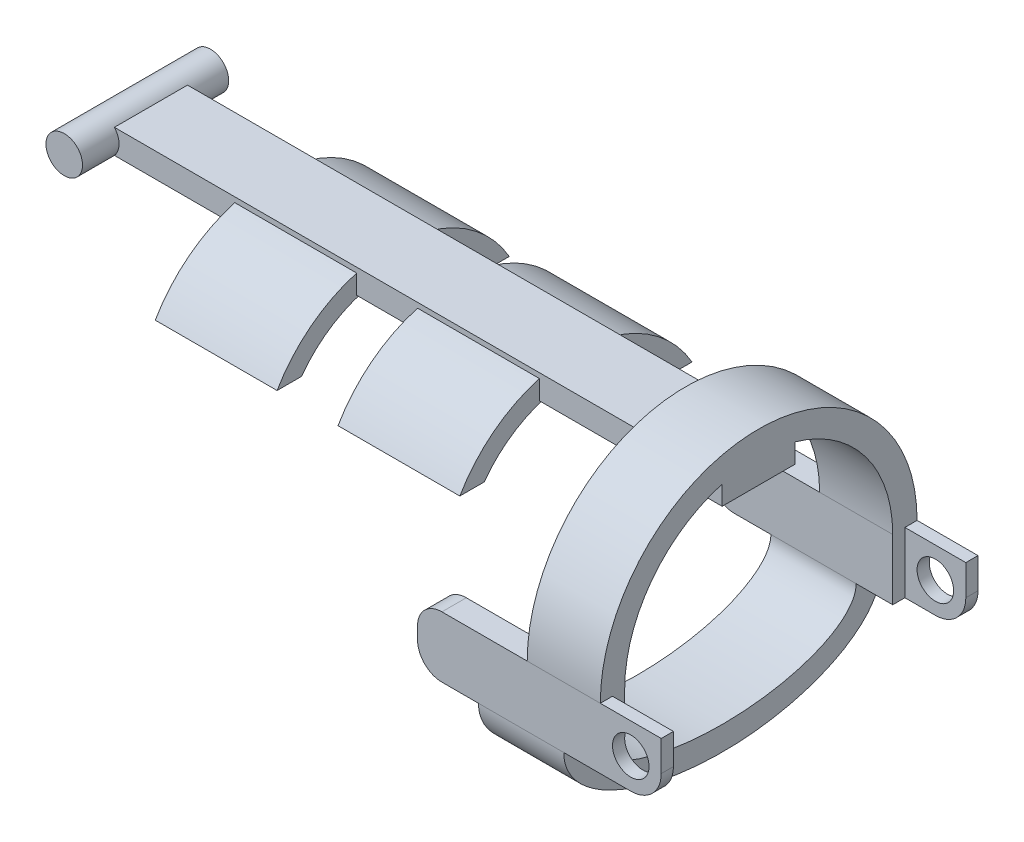
from build123d import *

# Parameters (mm, degrees)
SKETCH1_W                = 2
SKETCH1_H                = 5
BOSS_EXTRUDE1_DEPTH      = 15
BOSS_EXTRUDE1_2_DEPTH    = 15
SKETCH2_W                = 1
SKETCH2_H                = 5
BOSS_EXTRUDE2_DEPTH      = 5
CUT_EXTRUDE1_DEPTH       = 33.113081447
CUT_EXTRUDE1_DEPTH_BACK  = 33.113081447
SKETCH3_R                = 1.5
SWEEP1_START             = 9
SWEEP1_DEPTH             = 6
BOSS_EXTRUDE3_DEPTH      = 12
CUT_EXTRUDE2_DEPTH       = 5
FILLET1_R                = 2
BOSS_EXTRUDE6_START      = -6
SKETCH7_W                = 6
SKETCH7_H                = 2
BOSS_EXTRUDE6_DEPTH      = 51
BOSS_EXTRUDE7_DEPTH      = 3
BOSS_EXTRUDE7_DEPTH_BACK = 9
SKETCH8_R                = 1.5
FILLET2_R                = 2.5
BOSS_EXTRUDE10_DEPTH     = 10
LPATTERN1_COUNT          = 2
LPATTERN1_PITCH          = 15


# Read off the part's stored shape, not the designer's step: Sweep1
with BuildPart() as part:
    # Sketch1 → Boss-Extrude1 (new body)
    with BuildSketch(Plane(origin=(0, 0, 0), x_dir=(0, 0, -1), z_dir=(1, 0, 0))):
        with Locations((-12, 0)):
            Rectangle(SKETCH1_W, SKETCH1_H)
    extrude(amount=BOSS_EXTRUDE1_DEPTH)



with BuildPart() as body_2:
    # Sketch1 → Boss-Extrude1 2 (new body)
    with BuildSketch(Plane(origin=(0, 0, 0), x_dir=(0, 0, -1), z_dir=(1, 0, 0))):
        with Locations((12, 0)):
            Rectangle(SKETCH1_W, SKETCH1_H)
    extrude(amount=BOSS_EXTRUDE1_2_DEPTH)


with BuildPart() as part_1:
    add(part.part)

    add(body_2.part)  # Boss-Extrude2 merges body 2
    # Sketch2 → Boss-Extrude2 (add)
    with BuildSketch(Plane(origin=(15, 0, 0), x_dir=(0, 0, -1), z_dir=(1, 0, 0))):
        with Locations((12.5, 0)):
            Rectangle(SKETCH2_W, SKETCH2_H)
        with Locations((-12.5, 0)):
            Rectangle(SKETCH2_W, SKETCH2_H)
    extrude(amount=BOSS_EXTRUDE2_DEPTH)

    # Sketch3 → Cut-Extrude1 (cut, two sides: drawn at the far end of the back side and taken through both)
    with BuildSketch(Plane.XY.offset(-12).offset(-CUT_EXTRUDE1_DEPTH_BACK)):
        with Locations((17.5, 0)):
            Circle(SKETCH3_R)
    extrude(amount=CUT_EXTRUDE1_DEPTH + CUT_EXTRUDE1_DEPTH_BACK, mode=Mode.SUBTRACT)

    # Sweep1 outline → Sweep1 (add)
    with BuildSketch(Plane.YZ.offset(SWEEP1_START)):
        with BuildLine():
            ThreePointArc((2.5, -13), (15.5, 0), (2.5, 13))
            Line((2.5, 13), (2.5, 11))
            ThreePointArc((2.5, 11), (13.5, 0), (2.5, -11))
            Line((2.5, -11), (2.5, -13))
        make_face()
    extrude(amount=SWEEP1_DEPTH)

    # Sketch5 → Boss-Extrude3 (add)
    with BuildSketch(Plane(origin=(0, 0, 0), x_dir=(0, 0, -1), z_dir=(1, 0, 0))):
        with BuildLine():
            Line((-11, -2.5), (-13, -2.5))
            add(Edge.make_bspline(
                [(-13, -2.5), (-13, -8.980170496), (0, -8.980170496)],
                knots=[3.141592654, 3.141592654, 3.141592654, 4.71238898, 4.71238898, 4.71238898], degree=2, weights=[1, 0.707106781, 1]))
            Line((0, -8.980170496), (0, -7.009343108))
            add(Edge.make_bspline(
                [(-11, -2.5), (-11, -7.009343108), (0, -7.009343108)],
                knots=[3.141592654, 3.141592654, 3.141592654, 4.71238898, 4.71238898, 4.71238898], degree=2, weights=[1, 0.707106781, 1]))
        make_face()
    boss_extrude3 = extrude(amount=BOSS_EXTRUDE3_DEPTH)

    # Sketch6 → Cut-Extrude2 (cut)
    with BuildSketch(Plane.ZY):
        with BuildLine():
            Line((13, -2.5), (11, -2.5))
            add(Edge.make_bspline(
                [(0, -7.009343108), (11, -7.009343108), (11, -2.5)],
                knots=[4.71238898, 4.71238898, 4.71238898, 6.283185307, 6.283185307, 6.283185307], degree=2, weights=[1, 0.707106781, 1]))
            Line((0, -7.009343108), (0, -8.980170496))
            add(Edge.make_bspline(
                [(0, -8.980170496), (13, -8.980170496), (13, -2.5)],
                knots=[4.71238898, 4.71238898, 4.71238898, 6.283185307, 6.283185307, 6.283185307], degree=2, weights=[1, 0.707106781, 1]))
        make_face()
    cut_extrude2 = extrude(amount=-CUT_EXTRUDE2_DEPTH, mode=Mode.SUBTRACT)

    # Mirror2: Boss-Extrude3, Cut-Extrude2 across plane
    add(boss_extrude3.mirror(Plane(origin=(12, -8.980170496, 0), x_dir=(1, 0, 0), z_dir=(0, 0, 1))))
    add(cut_extrude2.mirror(Plane(origin=(12, -8.980170496, 0), x_dir=(1, 0, 0), z_dir=(0, 0, 1))), mode=Mode.SUBTRACT)

    # Fillet1
    fillet1_edges = [part_1.edges().sort_by_distance(p)[0] for p in [
        (0, -2.5, -12),
        (0, 2.5, -12),
        (0, 2.5, 12),
        (0, -2.5, 12),
    ]]
    fillet(fillet1_edges, radius=FILLET1_R)

    # Sketch7 → Boss-Extrude6 (add)
    with BuildSketch(Plane.ZY.offset(-9).offset(BOSS_EXTRUDE6_START)):
        with Locations((0, 12.5)):
            Rectangle(SKETCH7_W, SKETCH7_H)
    extrude(amount=BOSS_EXTRUDE6_DEPTH)

    # Sketch8 → Boss-Extrude7 (add, two sides: drawn at the far end of the back side and taken through both)
    with BuildSketch(Plane.XY.offset(3).offset(-BOSS_EXTRUDE7_DEPTH_BACK)):
        with Locations((-36, 12.5)):
            Circle(SKETCH8_R)
    extrude(amount=BOSS_EXTRUDE7_DEPTH + BOSS_EXTRUDE7_DEPTH_BACK)

    # Fillet2
    fillet2_edges = [part_1.edges().sort_by_distance(p)[0] for p in [
        (20, -2.5, -12.5),
        (20, -2.5, 12.5),
    ]]
    fillet(fillet2_edges, radius=FILLET2_R)

    # 3DSketch3 → Boss-Extrude10 (add)
    with BuildSketch(Plane(origin=(-10, 7.995255445, 9.529017137), x_dir=(0, 0, -1), z_dir=(1, 0, 0))):
        with BuildLine():
            Line((0, 0), (2, 0))
            ThreePointArc((2, 0), (9.529017137, 3.825899604), (17.058034273, 0))
            Line((17.058034273, 0), (19.058034273, 0))
            ThreePointArc((19.058034273, 0), (15.031388903, 4.029654263), (9.529017137, 5.504744555))
            ThreePointArc((9.529017137, 5.504744555), (4.026645371, 4.029654263), (0, 0))
        make_face()
    boss_extrude10 = extrude(amount=BOSS_EXTRUDE10_DEPTH)

    # LPattern1: Boss-Extrude10 ×2
    with Locations(*[(-i * LPATTERN1_PITCH, 0, 0) for i in range(1, LPATTERN1_COUNT)]):
        add(boss_extrude10)


solid = part_1.part
